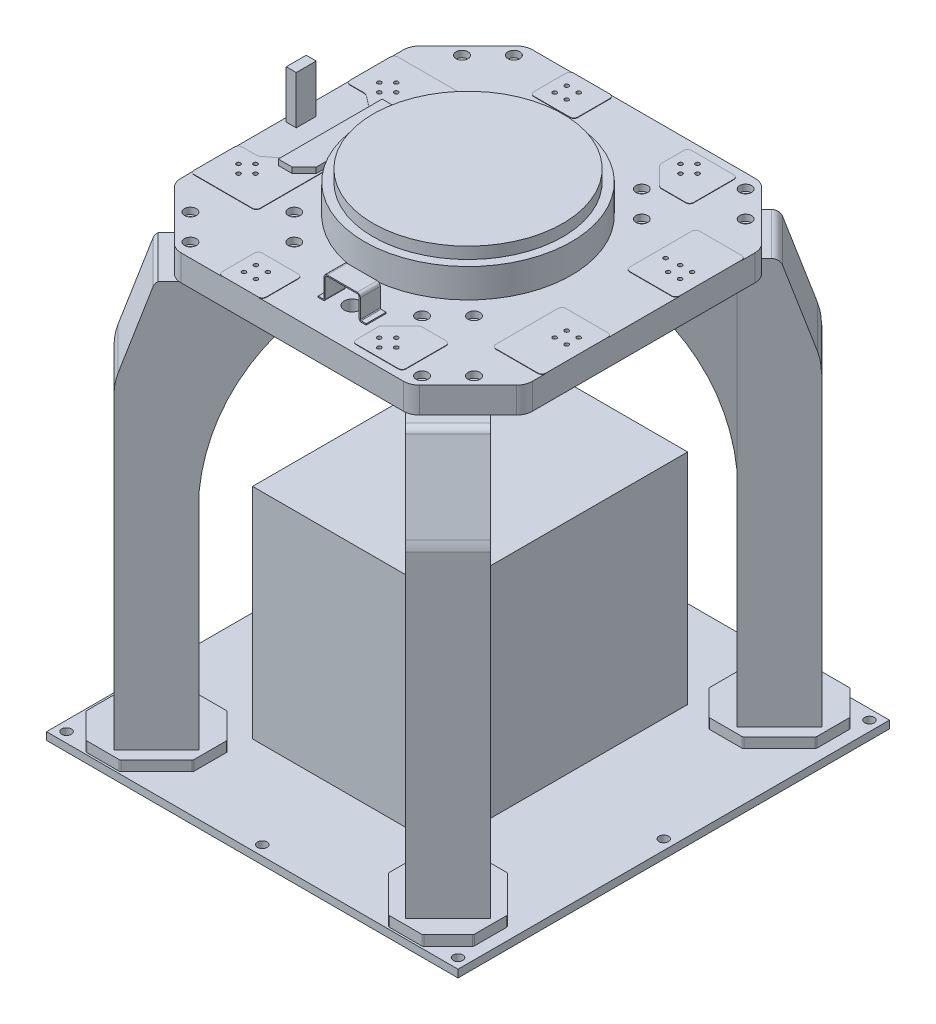
from build123d import *
from OCP.BRepAlgoAPI import BRepAlgoAPI_Cut
from OCP.TopTools import TopTools_ListOfShape

# Parameters (mm, degrees)
SKETCH4_W                                            = 1030
SKETCH4_H                                            = 1080
BASE_EXTRUDE_DEPTH                                   = 19.05
BOSS_EXTRUDE1_DEPTH                                  = 25.4
BOSS_EXTRUDE2_DEPTH                                  = 1016
BOSS_EXTRUDE3_DEPTH                                  = 177.8
BOSS_EXTRUDE3_DEPTH_BACK                             = 76.2
SKETCH9_W                                            = 150.000007
SKETCH9_H                                            = 457.2
BOSS_EXTRUDE4_DEPTH                                  = 177.8
BOSS_EXTRUDE4_DEPTH_BACK                             = 76.2
SKETCH12_W                                           = 150.000007
SKETCH12_H                                           = 457.2
CUT_EXTRUDE1_REACH                                   = 1365.161
CUT_EXTRUDE2_START                                   = -150.000004
CUT_EXTRUDE2_DEPTH                                   = 150.000006
BOSS_EXTRUDE5_DEPTH                                  = 177.8
BOSS_EXTRUDE5_DEPTH_BACK                             = 76.2
SKETCH14_W                                           = 150.000007
SKETCH14_H                                           = 457.2
BOSS_EXTRUDE6_DEPTH                                  = 177.8
BOSS_EXTRUDE6_DEPTH_BACK                             = 76.2
SKETCH15_W                                           = 150.000007
SKETCH15_H                                           = 457.2
CUT_EXTRUDE3_DEPTH                                   = 177.8
CUT_EXTRUDE4_START                                   = -150.000004
CUT_EXTRUDE4_DEPTH                                   = 150.000006
BOSS_EXTRUDE7_DEPTH                                  = 65.024
SKETCH19_W                                           = 469.9
SKETCH19_H                                           = 619.178727
BOSS_EXTRUDE8_DEPTH                                  = 547.624
SKETCH23_R                                           = 258.980392
BOSS_EXTRUDE12_DEPTH                                 = 72.5
SKETCH24_R                                           = 237.5
BOSS_EXTRUDE13_DEPTH                                 = 29
M24_0_24_000000_DIAMETER_HOLE1_D                     = 24
LPATTERN1_COUNT                                      = 3
LPATTERN1_PITCH                                      = 515
LPATTERN1_COUNT_DIR2                                 = 3
LPATTERN1_PITCH_DIR2                                 = 490
M16_FORO_LAMATO_PER_VITE_A_TESTA_ESAGONA_D           = 17.5
M16_FORO_LAMATO_PER_VITE_A_TESTA_ESAGONA_DEPTH       = 65.024
M16_FORO_LAMATO_PER_VITE_A_TESTA_ESAGONA_CBORE_D     = 30
M16_FORO_LAMATO_PER_VITE_A_TESTA_ESAGONA_CBORE_DEPTH = 16
SCHIZZO10_W                                          = 200
SCHIZZO10_H                                          = 140
ESTRUSIONE1_DEPTH                                    = 170
SCHIZZO11_R                                          = 20
TAGLIO_ESTRUSIONE4_DEPTH                             = 65.024
ESTRUSIONE2_DEPTH                                    = 1
M12_FORO_FILETTATO_PROFONDO1_D                       = 10.2
M12_FORO_FILETTATO_PROFONDO1_DEPTH                   = 66.024
SCHIZZO19_W                                          = 25
SCHIZZO19_H                                          = 50
ESTRUSIONE3_DEPTH                                    = 120
ESTRUSIONE4_DEPTH                                    = 15
ESTRUSIONE4_DEPTH_BACK                               = 5
ESTRUSIONE_SOTTILE1_START                            = -125
ESTRUSIONE_SOTTILE1_DEPTH                            = 50
SCHIZZO23_W                                          = 100
SCHIZZO23_H                                          = 100
ESTRUSIONE5_DEPTH                                    = 10
SMUSSO1_SIZE                                         = 5
ESTRUSIONE6_DEPTH                                    = 40


with BuildPart() as part:
    # Sketch4 → Base-Extrude (new body)
    with BuildSketch(Plane(origin=(0, 0, 0), x_dir=(1, 0, 0), z_dir=(0, 1, 0))):
        Rectangle(SKETCH4_W, SKETCH4_H)
    extrude(amount=BASE_EXTRUDE_DEPTH)

    # Sketch5 → Boss-Extrude1 (add)
    with BuildSketch(Plane(origin=(0, 19.05, 0), x_dir=(-1, 0, 0), z_dir=(0, 1, 0))):
        with BuildLine():
            Line((335.019684, -533.512103), (246.104734, -444.597152))
            ThreePointArc((246.104734, -444.597152), (245.003528, -442.949082), (244.616836, -441.00505))
            Line((244.616836, -441.00505), (244.61684, -360.360649))
            ThreePointArc((244.61684, -360.360649), (245.003532, -358.416617), (246.104737, -356.768546))
            Line((246.104737, -356.768546), (306.76855, -296.104734))
            ThreePointArc((306.76855, -296.104734), (308.416621, -295.003528), (310.360652, -294.616836))
            Line((310.360652, -294.616836), (391.00506, -294.616836))
            ThreePointArc((391.00506, -294.616836), (392.949091, -295.003528), (394.597163, -296.10473))
            Line((394.597163, -296.10473), (483.512103, -385.019674))
            ThreePointArc((483.512103, -385.019674), (484.613309, -386.667745), (485.000001, -388.611777))
            Line((485.000001, -388.611777), (485.000001, -469.256184))
            ThreePointArc((485.000001, -469.256184), (484.613309, -471.200216), (483.512103, -472.848287))
            Line((483.512103, -472.848287), (422.84829, -533.5121))
            ThreePointArc((422.84829, -533.5121), (421.20022, -534.613305), (419.256188, -534.999997))
            Line((419.256188, -534.999997), (338.611787, -535.000001))
            ThreePointArc((338.611787, -535.000001), (336.667755, -534.613309), (335.019684, -533.512103))
        make_face()
        with BuildLine():
            Line((-244.616836, -441.00505), (-244.61684, -360.360649))
            ThreePointArc((-244.61684, -360.360649), (-245.003532, -358.416617), (-246.104737, -356.768546))
            Line((-246.104737, -356.768546), (-306.76855, -296.104734))
            ThreePointArc((-306.76855, -296.104734), (-308.416621, -295.003528), (-310.360652, -294.616836))
            Line((-310.360652, -294.616836), (-391.00506, -294.616836))
            ThreePointArc((-391.00506, -294.616836), (-392.949091, -295.003528), (-394.597163, -296.10473))
            Line((-394.597163, -296.10473), (-483.512103, -385.019674))
            ThreePointArc((-483.512103, -385.019674), (-484.613309, -386.667745), (-485.000001, -388.611777))
            Line((-485.000001, -388.611777), (-485.000001, -469.256184))
            ThreePointArc((-485.000001, -469.256184), (-484.613309, -471.200216), (-483.512103, -472.848287))
            Line((-483.512103, -472.848287), (-422.84829, -533.5121))
            ThreePointArc((-422.84829, -533.5121), (-421.20022, -534.613305), (-419.256188, -534.999997))
            Line((-419.256188, -534.999997), (-338.611787, -535.000001))
            ThreePointArc((-338.611787, -535.000001), (-336.667755, -534.613309), (-335.019684, -533.512103))
            Line((-335.019684, -533.512103), (-246.104734, -444.597152))
            ThreePointArc((-246.104734, -444.597152), (-245.003528, -442.949082), (-244.616836, -441.00505))
        make_face()
        with BuildLine():
            Line((244.616836, 441.00505), (244.61684, 360.360649))
            ThreePointArc((244.61684, 360.360649), (245.003532, 358.416617), (246.104737, 356.768546))
            Line((246.104737, 356.768546), (306.76855, 296.104734))
            ThreePointArc((306.76855, 296.104734), (308.416621, 295.003528), (310.360652, 294.616836))
            Line((310.360652, 294.616836), (391.00506, 294.616836))
            ThreePointArc((391.00506, 294.616836), (392.949091, 295.003528), (394.597163, 296.10473))
            Line((394.597163, 296.10473), (483.512103, 385.019674))
            ThreePointArc((483.512103, 385.019674), (484.613309, 386.667745), (485.000001, 388.611777))
            Line((485.000001, 388.611777), (485.000001, 469.256184))
            ThreePointArc((485.000001, 469.256184), (484.613309, 471.200216), (483.512103, 472.848287))
            Line((483.512103, 472.848287), (422.84829, 533.5121))
            ThreePointArc((422.84829, 533.5121), (421.20022, 534.613305), (419.256188, 534.999997))
            Line((419.256188, 534.999997), (338.611787, 535.000001))
            ThreePointArc((338.611787, 535.000001), (336.667755, 534.613309), (335.019684, 533.512103))
            Line((335.019684, 533.512103), (246.104734, 444.597152))
            ThreePointArc((246.104734, 444.597152), (245.003528, 442.949082), (244.616836, 441.00505))
        make_face()
        with BuildLine():
            Line((-335.019684, 533.512103), (-246.104734, 444.597152))
            ThreePointArc((-246.104734, 444.597152), (-245.003528, 442.949082), (-244.616836, 441.00505))
            Line((-244.616836, 441.00505), (-244.61684, 360.360649))
            ThreePointArc((-244.61684, 360.360649), (-245.003532, 358.416617), (-246.104737, 356.768546))
            Line((-246.104737, 356.768546), (-306.76855, 296.104734))
            ThreePointArc((-306.76855, 296.104734), (-308.416621, 295.003528), (-310.360652, 294.616836))
            Line((-310.360652, 294.616836), (-391.00506, 294.616836))
            ThreePointArc((-391.00506, 294.616836), (-392.949091, 295.003528), (-394.597163, 296.10473))
            Line((-394.597163, 296.10473), (-483.512103, 385.019674))
            ThreePointArc((-483.512103, 385.019674), (-484.613309, 386.667745), (-485.000001, 388.611777))
            Line((-485.000001, 388.611777), (-485.000001, 469.256184))
            ThreePointArc((-485.000001, 469.256184), (-484.613309, 471.200216), (-483.512103, 472.848287))
            Line((-483.512103, 472.848287), (-422.84829, 533.5121))
            ThreePointArc((-422.84829, 533.5121), (-421.20022, 534.613305), (-419.256188, 534.999997))
            Line((-419.256188, 534.999997), (-338.611787, 535.000001))
            ThreePointArc((-338.611787, 535.000001), (-336.667755, 534.613309), (-335.019684, 533.512103))
        make_face()
    extrude(amount=BOSS_EXTRUDE1_DEPTH)

    # Sketch6 → Boss-Extrude2 (add)
    with BuildSketch(Plane(origin=(0, 44.45, 0), x_dir=(-1, 0, 0), z_dir=(0, 1, 0))):
        Polygon((364.791864, 520.85787), (470.857868, 414.791848), (364.792063, 308.726043), (258.72605, 414.792074), align=None)
        Polygon((258.72605, -414.792074), (364.792063, -308.726043), (470.857868, -414.791848), (364.791864, -520.85787), align=None)
        Polygon((-364.791864, -520.85787), (-470.857868, -414.791848), (-364.792063, -308.726043), (-258.72605, -414.792074), align=None)
        Polygon((-258.72605, 414.792074), (-364.792063, 308.726043), (-470.857868, 414.791848), (-364.791864, 520.85787), align=None)
    extrude(amount=BOSS_EXTRUDE2_DEPTH)

    # Sketch9 → Boss-Extrude3 (add, two sides: drawn at the far end of the back side and taken through both)
    with BuildSketch(Plane(origin=(-336.759084, 0, 336.759027), x_dir=(-0.7071067222412493, 0, -0.707106840131841), z_dir=(0.707106840131841, 0, -0.7071067222412493)).offset(-BOSS_EXTRUDE3_DEPTH_BACK)):
        with Locations((-35.355381, 831.85)):
            Rectangle(SKETCH9_W, SKETCH9_H)
    extrude(amount=BOSS_EXTRUDE3_DEPTH + BOSS_EXTRUDE3_DEPTH_BACK)

    # Sketch12 → Boss-Extrude4 (add, two sides: drawn at the far end of the back side and taken through both)
    with BuildSketch(Plane(origin=(-336.759084, 0, -336.759027), x_dir=(0.7071067222412493, 0, -0.707106840131841), z_dir=(0.707106840131841, 0, 0.7071067222412493)).offset(-BOSS_EXTRUDE4_DEPTH_BACK)):
        with Locations((35.355381, 831.85)):
            Rectangle(SKETCH12_W, SKETCH12_H)
    extrude(amount=BOSS_EXTRUDE4_DEPTH + BOSS_EXTRUDE4_DEPTH_BACK)

    # Sketch11 → Cut-Extrude1 (cut, up to next)
    with BuildSketch(Plane(origin=(78.033034, 0, 78.033047), x_dir=(0.7071068401318419, 0, -0.7071067222412484), z_dir=(0.7071067222412484, 0, 0.7071068401318419)), mode=Mode.PRIVATE) as cut_extrude1_sk1:
        with BuildLine():
            Line((-476.249224, 603.070662), (-476.249224, 537.249112))
            Line((-476.249224, 537.249112), (-191.197117, 537.249112))
            Line((-191.197117, 537.249112), (-191.197117, 1012.381678))
            Line((-191.197117, 1012.381678), (-297.66446, 1012.381678))
            ThreePointArc((-297.66446, 1012.381678), (-299.934967, 994.691688), (-309.233278, 979.472215))
            ThreePointArc((-309.233278, 979.472215), (-425.163771, 805.657877), (-476.249224, 603.070662))
        make_face()
    cut_extrude1_tool1 = extrude(cut_extrude1_sk1.sketch, amount=-CUT_EXTRUDE1_REACH, mode=Mode.PRIVATE) & part.part
    # Sketch11 → Cut-Extrude1 (cut, up to next)
    with BuildSketch(Plane(origin=(78.033034, 0, 78.033047), x_dir=(0.7071068401318419, 0, -0.7071067222412484), z_dir=(0.7071067222412484, 0, 0.7071068401318419)), mode=Mode.PRIVATE) as cut_extrude1_sk2:
        with BuildLine():
            Line((-619.187248, 862.834274), (-557.397589, 1049.461065))
            ThreePointArc((-557.397589, 1049.461065), (-550.244945, 1059.219873), (-538.732571, 1062.942761))
            Line((-538.732571, 1062.942761), (-533.613663, 1077.567942))
            Line((-533.613663, 1077.567942), (-868.111305, 1077.567942))
            Line((-868.111305, 1077.567942), (-868.111305, 812.900685))
            Line((-868.111305, 812.900685), (-626.248924, 812.900685))
            ThreePointArc((-626.248924, 812.900685), (-624.961589, 838.184759), (-619.187248, 862.834274))
        make_face()
    cut_extrude1_tool2 = extrude(cut_extrude1_sk2.sketch, amount=-CUT_EXTRUDE1_REACH, mode=Mode.PRIVATE) & part.part
    add(cut_extrude1_tool1.solids().sort_by_distance((-142.622671, 741.960708, 298.688714))[0], mode=Mode.SUBTRACT)
    add(cut_extrude1_tool2.solids().sort_by_distance((-436.749289, 952.347173, 592.815283))[0], mode=Mode.SUBTRACT)


with BuildPart() as cut_extrude2_tool:
    # Cut-Extrude2: read off the stored shape, not the designer's step
    # Cut-Extrude2 outline → Cut-Extrude2 (new body)
    with BuildSketch(Plane(origin=(-350.833008, 257.130059, -294.766994), x_dir=(0.707106840131841, 0, 0.7071067222412493), z_dir=(-0.7071067222412493, 0, 0.707106840131841)).offset(CUT_EXTRUDE2_START)):
        with BuildLine():
            ThreePointArc((158.058919, 743.784433), (154.085193, 732.782128), (147.274865, 723.271048))
            ThreePointArc((147.274865, 723.271048), (31.344372, 549.456711), (-19.741081, 346.869496))
            Line((-19.741081, 346.869496), (-19.741081, 346.119941))
            Line((-19.741081, 346.119941), (158.058919, 346.119941))
            Line((158.058919, 346.119941), (158.058919, 743.784433))
        make_face()
        with BuildLine():
            ThreePointArc((-100.623705, 793.259899), (-97.660377, 798.913544), (-93.042077, 803.319941))
            Line((-93.042077, 803.319941), (-169.740781, 803.319941))
            Line((-169.740781, 803.319941), (-169.740781, 556.699518))
            Line((-169.740781, 556.699518), (-169.47504, 556.699518))
            ThreePointArc((-169.47504, 556.699518), (-168.187706, 581.983592), (-162.413364, 606.633108))
            Line((-162.413364, 606.633108), (-100.623705, 793.259899))
        make_face()
    extrude(amount=CUT_EXTRUDE2_DEPTH)


with BuildPart() as part_1:
    add(part.part)

    # Cut-Extrude2: cut by cut_extrude2_tool, with a tolerance
    cut_extrude2_stock = TopTools_ListOfShape()
    cut_extrude2_stock.Append(part_1.part.wrapped)
    cut_extrude2_tools = TopTools_ListOfShape()
    cut_extrude2_tools.Append(cut_extrude2_tool.part.wrapped)
    cut_extrude2_cut = BRepAlgoAPI_Cut()
    cut_extrude2_cut.SetArguments(cut_extrude2_stock)
    cut_extrude2_cut.SetTools(cut_extrude2_tools)
    cut_extrude2_cut.SetFuzzyValue(0.00001)
    cut_extrude2_cut.Build()
    add(Compound.cast(cut_extrude2_cut.Shape()).solids(), mode=Mode.REPLACE)

    # Sketch14 → Boss-Extrude5 (add, two sides: drawn at the far end of the back side and taken through both)
    with BuildSketch(Plane(origin=(336.759084, 0, -336.759027), x_dir=(0.7071067222412493, 0, 0.707106840131841), z_dir=(-0.707106840131841, 0, 0.7071067222412493)).offset(-BOSS_EXTRUDE5_DEPTH_BACK)):
        with Locations((-35.355381, 831.85)):
            Rectangle(SKETCH14_W, SKETCH14_H)
    extrude(amount=BOSS_EXTRUDE5_DEPTH + BOSS_EXTRUDE5_DEPTH_BACK)

    # Sketch15 → Boss-Extrude6 (add, two sides: drawn at the far end of the back side and taken through both)
    with BuildSketch(Plane(origin=(336.759084, 0, 336.759027), x_dir=(-0.7071067222412493, 0, 0.707106840131841), z_dir=(-0.707106840131841, 0, -0.7071067222412493)).offset(-BOSS_EXTRUDE6_DEPTH_BACK)):
        with Locations((35.355381, 831.85)):
            Rectangle(SKETCH15_W, SKETCH15_H)
    extrude(amount=BOSS_EXTRUDE6_DEPTH + BOSS_EXTRUDE6_DEPTH_BACK)

    # Sketch16 → Cut-Extrude3 (cut)
    with BuildSketch(Plane(origin=(290.2639, -37.360583, -446.329919), x_dir=(-0.7071068401318419, 0, 0.7071067222412484), z_dir=(-0.7071067222412484, 0, -0.7071068401318419))):
        with BuildLine():
            Line((44.601252, 637.280498), (44.601252, 571.458948))
            Line((44.601252, 571.458948), (329.653358, 571.458948))
            Line((329.653358, 571.458948), (329.653358, 1046.591514))
            Line((329.653358, 1046.591514), (223.186015, 1046.591514))
            ThreePointArc((223.186015, 1046.591514), (220.915509, 1028.901524), (211.617197, 1013.682051))
            ThreePointArc((211.617197, 1013.682051), (95.686704, 839.867714), (44.601252, 637.280498))
        make_face()
        with BuildLine():
            Line((-97.595098, 897.04411), (-35.805438, 1083.670902))
            ThreePointArc((-35.805438, 1083.670902), (-28.303704, 1093.905996), (-16.229459, 1097.810583))
            Line((-16.229459, 1097.810583), (-12.021512, 1111.777778))
            Line((-12.021512, 1111.777778), (-346.519155, 1111.777778))
            Line((-346.519155, 1111.777778), (-346.519155, 847.110521))
            Line((-346.519155, 847.110521), (-104.656773, 847.110521))
            ThreePointArc((-104.656773, 847.110521), (-103.369439, 872.394595), (-97.595098, 897.04411))
        make_face()
    extrude(amount=-CUT_EXTRUDE3_DEPTH, mode=Mode.SUBTRACT)


with BuildPart() as cut_extrude4_tool:
    # Cut-Extrude4: read off the stored shape, not the designer's step
    # Cut-Extrude4 outline → Cut-Extrude4 (new body)
    with BuildSketch(Plane(origin=(465.843925, 286.86694, 409.777892), x_dir=(-0.707106840131841, 0, -0.7071067222412493), z_dir=(0.7071067222412493, 0, -0.707106840131841)).offset(CUT_EXTRUDE4_START)):
        with BuildLine():
            ThreePointArc((320.708904, 710.890575), (316.735179, 699.88827), (309.92485, 690.37719))
            ThreePointArc((309.92485, 690.37719), (194.431183, 517.664095), (142.908904, 316.38306))
            Line((142.908904, 316.38306), (320.708904, 316.38306))
            Line((320.708904, 316.38306), (320.708904, 710.890575))
        make_face()
        with BuildLine():
            ThreePointArc((60.048556, 760.366041), (65.932382, 769.126622), (75.498331, 773.58306))
            Line((75.498331, 773.58306), (-7.090796, 773.58306))
            Line((-7.090796, 773.58306), (-7.090796, 551.889944))
            ThreePointArc((-7.090796, 551.889944), (-4.851015, 562.92112), (-1.741103, 573.739249))
            Line((-1.741103, 573.739249), (60.048556, 760.366041))
        make_face()
    extrude(amount=CUT_EXTRUDE4_DEPTH)


with BuildPart() as part_2:
    add(part_1.part)

    # Cut-Extrude4: cut by cut_extrude4_tool, with a tolerance
    cut_extrude4_stock = TopTools_ListOfShape()
    cut_extrude4_stock.Append(part_2.part.wrapped)
    cut_extrude4_tools = TopTools_ListOfShape()
    cut_extrude4_tools.Append(cut_extrude4_tool.part.wrapped)
    cut_extrude4_cut = BRepAlgoAPI_Cut()
    cut_extrude4_cut.SetArguments(cut_extrude4_stock)
    cut_extrude4_cut.SetTools(cut_extrude4_tools)
    cut_extrude4_cut.SetFuzzyValue(0.00001)
    cut_extrude4_cut.Build()
    add(Compound.cast(cut_extrude4_cut.Shape()).solids(), mode=Mode.REPLACE)

    # Sketch18 → Boss-Extrude7 (add)
    with BuildSketch(Plane(origin=(0, 1060.45, 0), x_dir=(-1, 0, 0), z_dir=(0, 1, 0))):
        with BuildLine():
            Line((278.5, -440.000001), (-278.5, -440.000001))
            ThreePointArc((-278.5, -440.000001), (-293.807337, -436.955182), (-306.784271, -428.284272))
            Line((-306.784271, -428.284272), (-428.284271, -306.784272))
            ThreePointArc((-428.284271, -306.784272), (-436.955181, -293.807338), (-440, -278.500001))
            Line((-440, -278.500001), (-440, 278.500001))
            ThreePointArc((-440, 278.500001), (-436.955181, 293.807338), (-428.284271, 306.784272))
            Line((-428.284271, 306.784272), (-306.784271, 428.284272))
            ThreePointArc((-306.784271, 428.284272), (-293.807337, 436.955182), (-278.5, 440.000001))
            Line((-278.5, 440.000001), (278.5, 440.000001))
            ThreePointArc((278.5, 440.000001), (293.807338, 436.955182), (306.784272, 428.284271))
            Line((306.784272, 428.284271), (428.284272, 306.784267))
            ThreePointArc((428.284272, 306.784267), (436.955181, 293.807333), (440, 278.499996))
            Line((440, 278.499996), (440, -278.500001))
            ThreePointArc((440, -278.500001), (436.955181, -293.807338), (428.284271, -306.784272))
            Line((428.284271, -306.784272), (306.784271, -428.284272))
            ThreePointArc((306.784271, -428.284272), (293.807337, -436.955182), (278.5, -440.000001))
        make_face()
    extrude(amount=BOSS_EXTRUDE7_DEPTH)

    # Sketch19 → Boss-Extrude8 (add)
    with BuildSketch(Plane(origin=(0, 19.05, 0), x_dir=(-1, 0, 0), z_dir=(0, 1, 0))):
        with Locations((6.35, -11.583793)):
            Rectangle(SKETCH19_W, SKETCH19_H)
    extrude(amount=BOSS_EXTRUDE8_DEPTH)

    # Sketch23 → Boss-Extrude12 (add)
    with BuildSketch(Plane(origin=(0, 1125.474, 0), x_dir=(-1, 0, 0), z_dir=(0, 1, 0))):
        with Locations(Location((0, 0, 0), (0, 0, 90))):
            Circle(SKETCH23_R)
    extrude(amount=BOSS_EXTRUDE12_DEPTH)

    # Sketch24 → Boss-Extrude13 (add)
    with BuildSketch(Plane(origin=(0, 1197.974, 0), x_dir=(-1, 0, 0), z_dir=(0, 1, 0))):
        with Locations(Location((0, 0, 0), (0, 0, 90))):
            Circle(SKETCH24_R)
    extrude(amount=BOSS_EXTRUDE13_DEPTH)

    # M24.0 (24.000000) Diameter Hole1 (through all)
    with Locations(Plane(origin=(0, 19.05, 0), x_dir=(-1, 0, 0), z_dir=(0, 1, 0))):
        with Locations((-490, 515)):
            m24_0_24_000000_diameter_hole1 = Hole(M24_0_24_000000_DIAMETER_HOLE1_D / 2)

    # LPattern1: M24.0 _24.000000_ Diameter Hole1 3 × 3, 1 skipped
    with Locations(*[(-j * LPATTERN1_PITCH_DIR2, 0, -i * LPATTERN1_PITCH) for i in range(LPATTERN1_COUNT) for j in range(LPATTERN1_COUNT_DIR2) if (i, j) not in ((0, 0), (1, 1))]):
        add(m24_0_24_000000_diameter_hole1, mode=Mode.SUBTRACT)

    # M16 Foro lamato per vite a testa esagonale (parzialmente filettata)1
    with Locations(Plane(origin=(0, 1125.474, 0), x_dir=(-1, 0, 0), z_dir=(0, 1, 0))):
        with Locations((290, -405), (355, -340), (-290, -405), (-355, -340), (-355, 340), (-290, 405), (290, 405), (355, 340), (-225, 210), (-160, 275), (160, 275), (225, 210), (-225, -210), (-160, -275), (160, -275), (225, -210)):
            CounterBoreHole(M16_FORO_LAMATO_PER_VITE_A_TESTA_ESAGONA_D / 2, M16_FORO_LAMATO_PER_VITE_A_TESTA_ESAGONA_CBORE_D / 2, M16_FORO_LAMATO_PER_VITE_A_TESTA_ESAGONA_CBORE_DEPTH, depth=M16_FORO_LAMATO_PER_VITE_A_TESTA_ESAGONA_DEPTH)

    # Schizzo10 → Estrusione1 (add)
    with BuildSketch(Plane.XZ.offset(-1060.45)):
        with Locations((-350, -100)):
            Rectangle(SCHIZZO10_W, SCHIZZO10_H)
    extrude(amount=ESTRUSIONE1_DEPTH)

    # Schizzo11 → Taglio-Estrusione4 (cut)
    with BuildSketch(Plane(origin=(0, 1125.474, 0), x_dir=(-1, 0, 0), z_dir=(0, 1, 0))):
        with Locations(Location((-50, 340.000001, 0), (0, 0, 90))):
            Circle(SCHIZZO11_R)
    extrude(amount=-TAGLIO_ESTRUSIONE4_DEPTH, mode=Mode.SUBTRACT)

    # Schizzo13 → Estrusione2 (add)
    with BuildSketch(Plane(origin=(0, 1125.474, 0), x_dir=(-1, 0, 0), z_dir=(0, 1, 0))):
        with BuildLine():
            Line((185, -430), (185, -350))
            ThreePointArc((185, -350), (182.071068, -342.928932), (175, -340))
            Line((175, -340), (85, -340))
            ThreePointArc((85, -340), (77.928932, -342.928932), (75, -350))
            Line((75, -350), (75, -430))
            ThreePointArc((75, -430), (77.928932, -437.071068), (85, -440))
            Line((85, -440), (175, -440))
            ThreePointArc((175, -440), (182.071068, -437.071068), (185, -430))
        make_face()
        with BuildLine():
            Line((-177.071068, -302.928932), (-132.928932, -347.071068))
            ThreePointArc((-132.928932, -347.071068), (-130.761205, -350.315301), (-130, -354.142136))
            Line((-130, -354.142136), (-130, -410))
            ThreePointArc((-130, -410), (-132.928932, -417.071068), (-140, -420))
            Line((-140, -420), (-245, -420))
            ThreePointArc((-245, -420), (-252.071068, -417.071068), (-255, -410))
            Line((-255, -410), (-255, -310))
            ThreePointArc((-255, -310), (-252.071068, -302.928932), (-245, -300))
            Line((-245, -300), (-184.142136, -300))
            ThreePointArc((-184.142136, -300), (-180.315301, -300.761205), (-177.071068, -302.928932))
        make_face()
        with BuildLine():
            Line((-325, -255), (-430, -255))
            ThreePointArc((-430, -255), (-437.071068, -252.071068), (-440, -245))
            Line((-440, -245), (-440, -90))
            ThreePointArc((-440, -90), (-437.071068, -82.928932), (-430, -80))
            Line((-430, -80), (-325, -80))
            ThreePointArc((-325, -80), (-317.928932, -82.928932), (-315, -90))
            Line((-315, -90), (-315, -245))
            ThreePointArc((-315, -245), (-317.928932, -252.071068), (-325, -255))
        make_face()
        with BuildLine():
            Line((-315, 245), (-315, 90))
            ThreePointArc((-315, 90), (-317.928932, 82.928932), (-325, 80))
            Line((-325, 80), (-430, 80))
            ThreePointArc((-430, 80), (-437.071068, 82.928932), (-440, 90))
            Line((-440, 90), (-440, 245))
            ThreePointArc((-440, 245), (-437.071068, 252.071068), (-430, 255))
            Line((-430, 255), (-325, 255))
            ThreePointArc((-325, 255), (-317.928932, 252.071068), (-315, 245))
        make_face()
        with BuildLine():
            Line((-184.142126, 300), (-245, 300))
            ThreePointArc((-245, 300), (-252.071068, 302.928932), (-255, 310))
            Line((-255, 310), (-255, 410))
            ThreePointArc((-255, 410), (-252.071068, 417.071068), (-245, 420))
            Line((-245, 420), (-140, 420))
            ThreePointArc((-140, 420), (-132.928932, 417.071068), (-130, 410))
            Line((-130, 410), (-130, 354.142126))
            ThreePointArc((-130, 354.142126), (-130.761205, 350.315291), (-132.928932, 347.071058))
            Line((-132.928932, 347.071058), (-177.071058, 302.928932))
            ThreePointArc((-177.071058, 302.928932), (-180.315291, 300.761205), (-184.142126, 300))
        make_face()
        with BuildLine():
            Line((175, 340), (85, 340))
            ThreePointArc((85, 340), (77.928932, 342.928932), (75, 350))
            Line((75, 350), (75, 430))
            ThreePointArc((75, 430), (77.928932, 437.071068), (85, 440))
            Line((85, 440), (175, 440))
            ThreePointArc((175, 440), (182.071068, 437.071068), (185, 430))
            Line((185, 430), (185, 350))
            ThreePointArc((185, 350), (182.071068, 342.928932), (175, 340))
        make_face()
        with BuildLine():
            Line((430, 255), (285, 255))
            ThreePointArc((285, 255), (277.928932, 252.071068), (275, 245))
            Line((275, 245), (275, 65.24723))
            ThreePointArc((275, 65.24723), (280.627788, 56.25369), (291.176752, 57.382897))
            Line((291.176752, 57.382897), (384.561675, 130.728666))
            ThreePointArc((384.561675, 130.728666), (390.379635, 133.902028), (396.91518, 135))
            Line((396.91518, 135), (430, 135))
            ThreePointArc((430, 135), (437.071068, 137.928932), (440, 145))
            Line((440, 145), (440, 245))
            ThreePointArc((440, 245), (437.071068, 252.071068), (430, 255))
        make_face()
        with BuildLine():
            Line((275, -65.24724), (275, -245))
            ThreePointArc((275, -245), (277.928932, -252.071068), (285, -255))
            Line((285, -255), (430, -255))
            ThreePointArc((430, -255), (437.071068, -252.071068), (440, -245))
            Line((440, -245), (440, -145))
            ThreePointArc((440, -145), (437.071068, -137.928932), (430, -135))
            Line((430, -135), (396.91518, -135))
            ThreePointArc((396.91518, -135), (390.379636, -133.902028), (384.561676, -130.728667))
            Line((384.561676, -130.728667), (291.176752, -57.382907))
            ThreePointArc((291.176752, -57.382907), (280.627788, -56.2537), (275, -65.24724))
        make_face()
    extrude(amount=ESTRUSIONE2_DEPTH)

    # M12 Foro filettato profondo1
    with Locations(Plane(origin=(0, 1126.474, 0), x_dir=(-1, 0, 0), z_dir=(0, 1, 0))):
        with Locations((-340.673427, -153.927482), (-404, -157), (-374, -157), (-374, -127), (-404, -127), (-404, 127), (-404, 157), (-374, 157), (-374, 127), (-197.4264, 377), (-176.2132, 398.2132), (-155, 377), (-176.2132, 355.78679), (127, 374), (127, 404), (157, 404), (157, 374), (355.7868, 176.2132), (377, 197.4264), (398.21321, 176.2132), (377, 155), (355.7868, -176.21321), (377, -155), (398.21321, -176.21321), (377, -197.42641), (127, -374), (127, -404), (157, -404), (157, -374), (-176.2132, -398.21321), (-197.4264, -377), (-176.2132, -355.7868), (-155, -377)):
            Hole(M12_FORO_FILETTATO_PROFONDO1_D / 2, depth=M12_FORO_FILETTATO_PROFONDO1_DEPTH)

    # Schizzo19 → Estrusione3 (add)
    with BuildSketch(Plane(origin=(0, 1125.474, 0), x_dir=(-1, 0, 0), z_dir=(0, 1, 0))):
        with Locations((417.5, 0)):
            Rectangle(SCHIZZO19_W, SCHIZZO19_H)
    extrude(amount=ESTRUSIONE3_DEPTH)

    # Schizzo20 → Estrusione4 (add, two sides: drawn at the far end of the back side and taken through both)
    with BuildSketch(Plane(origin=(0, 1125.474, 0), x_dir=(-1, 0, 0), z_dir=(0, 1, 0)).offset(-ESTRUSIONE4_DEPTH_BACK)):
        Polygon((310, -130), (345, -130), (345, 130), (310, 130), (280, 100), (280, -100), align=None)
    extrude(amount=ESTRUSIONE4_DEPTH + ESTRUSIONE4_DEPTH_BACK)

    # Schizzo22 → Estrusione-Sottile1 (add)
    with BuildSketch(Plane.XY.offset(440.000001).offset(ESTRUSIONE_SOTTILE1_START)):
        with BuildLine():
            Line((-10, 1125.474), (2.5, 1125.474))
            ThreePointArc((2.5, 1125.474), (6.035534, 1126.938466), (7.5, 1130.474))
            Line((7.5, 1130.474), (7.5, 1177.474))
            ThreePointArc((7.5, 1177.474), (8.964466, 1181.009534), (12.5, 1182.474))
            Line((12.5, 1182.474), (87.5, 1182.474))
            ThreePointArc((87.5, 1182.474), (91.035534, 1181.009534), (92.5, 1177.474))
            Line((92.5, 1177.474), (92.5, 1130.474))
            ThreePointArc((92.5, 1130.474), (93.964466, 1126.938466), (97.5, 1125.474))
            Line((97.5, 1125.474), (110, 1125.474))
            Line((110, 1125.474), (110, 1128.474))
            Line((110, 1128.474), (97.5, 1128.474))
            ThreePointArc((97.5, 1128.474), (96.085786, 1129.059786), (95.5, 1130.474))
            Line((95.5, 1130.474), (95.5, 1177.474))
            ThreePointArc((95.5, 1177.474), (93.156854, 1183.130854), (87.5, 1185.474))
            Line((87.5, 1185.474), (12.5, 1185.474))
            ThreePointArc((12.5, 1185.474), (6.843146, 1183.130854), (4.5, 1177.474))
            Line((4.5, 1177.474), (4.5, 1130.474))
            ThreePointArc((4.5, 1130.474), (3.914214, 1129.059786), (2.5, 1128.474))
            Line((2.5, 1128.474), (-10, 1128.474))
            Line((-10, 1128.474), (-10, 1125.474))
        make_face()
    extrude(amount=ESTRUSIONE_SOTTILE1_DEPTH)

    # Schizzo23 → Estrusione5 (add)
    with BuildSketch(Plane.ZY.offset(450)):
        with Locations((-100, 975.45)):
            Rectangle(SCHIZZO23_W, SCHIZZO23_H)
    extrude(amount=ESTRUSIONE5_DEPTH)

    # Smusso1
    smusso1_edges = [part_2.edges().sort_by_distance(p)[0] for p in [
        (-460, 975.45, -150),
        (-460, 925.45, -100),
        (-460, 975.45, -50),
        (-460, 1025.45, -100),
    ]]
    chamfer(smusso1_edges, length=SMUSSO1_SIZE)

    # Schizzo24 → Estrusione6 (add, symmetric)
    with BuildSketch(Plane.XY):
        Polygon((-115, 1060.45), (-75, 910.45), (75, 910.45), (115, 1060.45), align=None)
    extrude(amount=ESTRUSIONE6_DEPTH, both=True)


solid = part_2.part
